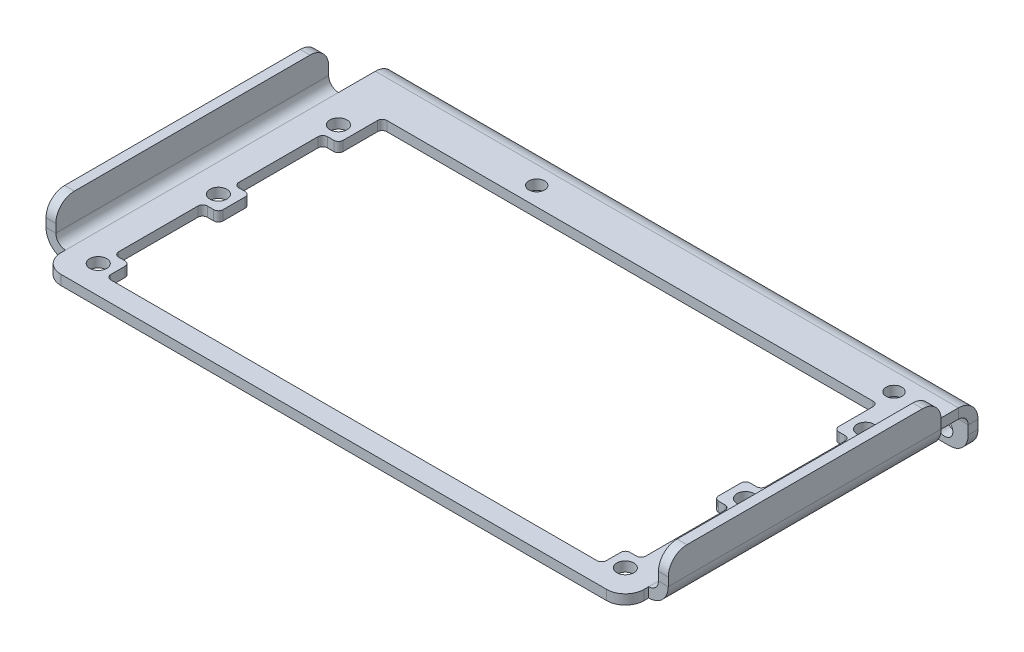
from build123d import *

# Parameters (mm, degrees)
SKETCH1_W                    = 125
SKETCH1_H                    = 73.5
BASE_FLANGE1_DEPTH           = 2.1
EDGE_FLANGE1_STRIP_W         = 12.6
EDGE_FLANGE1_STRIP_H         = 2.1
EDGE_FLANGE1_STRIP_CUT_DEPTH = 125
EDGE_FLANGE1_DEPTH           = 125
CUT_EXTRUDE1_REACH           = 148.302
PSU_MOUNTING_HOLES_D         = 3.6576
FILLET1_R                    = 1
SSD_MOUNTING_HOLES_D         = 3.4
M3_CLEARANCE_HOLE1_D         = 3.4
EDGE_FLANGE2_DEPTH           = 58.5
EDGE_FLANGE2_BEND_DEPTH      = 58.5
FILLET2_R                    = 4


# Sheet-metal steps are written as plain solids
with BuildPart() as part:
    # Sketch1 → Base-Flange1 (new body)
    with BuildSketch(Plane(origin=(0, 0, 0), x_dir=(1, 0, 0), z_dir=(0, 1, 0))):
        with Locations((62.5, 36.75)):
            Rectangle(SKETCH1_W, SKETCH1_H)
    extrude(amount=-BASE_FLANGE1_DEPTH)

    # Edge-Flange1 strip (across the edge) → Edge-Flange1 strip cut (cut)
    with BuildSketch(Plane(origin=(0, -2.1, -73.5), x_dir=(0, 0, 1), z_dir=(1, 0, 0))):
        with Locations((-4.2, -1.05)):
            Rectangle(EDGE_FLANGE1_STRIP_W, EDGE_FLANGE1_STRIP_H)
    extrude(amount=EDGE_FLANGE1_STRIP_CUT_DEPTH, mode=Mode.SUBTRACT)

    # Edge-Flange1 section (across the edge) → Edge-Flange1 (add)
    with BuildSketch(Plane(origin=(0, -2.1, -73.5), x_dir=(0, 0, 1), z_dir=(1, 0, 0))):
        with BuildLine():
            Line((-2.1, 2.1), (-2.1, 8))
            Line((-2.1, 8), (0, 8))
            Line((0, 8), (0, 2.1))
            ThreePointArc((0, 2.1), (0.61507576, 0.61507576), (2.1, 0))
            Line((2.1, 0), (2.1, -2.1))
            ThreePointArc((2.1, -2.1), (-0.869848481, -0.869848481), (-2.1, 2.1))
        make_face()
    extrude(amount=EDGE_FLANGE1_DEPTH)

    # Sketch7 → Cut-Extrude1 (cut, up to next)
    with BuildSketch(Plane(origin=(0, -2.1, 0), x_dir=(-1, 0, 0), z_dir=(0, -1, 0)), mode=Mode.PRIVATE) as cut_extrude1_sk1:
        Polygon((-115.625, 28.375), (-119, 28.375), (-119, 9.375), (-115.625, 9.375), (-115.625, 4.3), (-9.375, 4.3), (-9.375, 9.375), (-6, 9.375), (-6, 28.375), (-9.375, 28.375), (-9.375, 35.125), (-6, 35.125), (-6, 54.125), (-9.375, 54.125), (-9.375, 63.5), (-115.625, 63.5), (-115.625, 54.125), (-119, 54.125), (-119, 35.125), (-115.625, 35.125), align=None)
    cut_extrude1_tool1 = extrude(cut_extrude1_sk1.sketch, amount=-CUT_EXTRUDE1_REACH, mode=Mode.PRIVATE) & part.part
    add(cut_extrude1_tool1.solids().sort_by_distance((62.5, -2.1, -33.81576))[0], mode=Mode.SUBTRACT)

    # psu-mounting-holes (through all)
    with Locations(Plane(origin=(0, 0, 0), x_dir=(1, 0, 0), z_dir=(0, 1, 0))):
        with Locations((119, 6), (119, 57.5), (6, 6), (6, 57.5), (6, 31.75), (119, 31.75)):
            Hole(PSU_MOUNTING_HOLES_D / 2)

    # Fillet1
    fillet1_edges = [part.edges().sort_by_distance(p)[0] for p in [
        (119, -1.05, -28.375),
        (115.625, -1.05, -28.375),
        (115.625, -1.05, -35.125),
        (119, -1.05, -35.125),
        (119, -1.05, -54.125),
        (115.625, -1.05, -54.125),
        (115.625, -1.05, -63.5),
        (9.375, -1.05, -63.5),
        (9.375, -1.05, -54.125),
        (6, -1.05, -54.125),
        (6, -1.05, -35.125),
        (9.375, -1.05, -35.125),
        (9.375, -1.05, -28.375),
        (6, -1.05, -28.375),
        (6, -1.05, -9.375),
        (9.375, -1.05, -9.375),
        (9.375, -1.05, -4.3),
        (115.625, -1.05, -4.3),
        (115.625, -1.05, -9.375),
        (119, -1.05, -9.375),
    ]]
    fillet(fillet1_edges, radius=FILLET1_R)

    # ssd-mounting-holes (through all)
    with Locations(Plane(origin=(0, 0, 0), x_dir=(1, 0, 0), z_dir=(0, 1, 0))):
        with Locations((115.1, 67.5), (38.5, 67.5)):
            Hole(SSD_MOUNTING_HOLES_D / 2)

    # M3 Clearance Hole1 (through all)
    with Locations(Plane.XY.offset(-73.5)):
        with Locations((120, -7.15), (5, -7.15)):
            Hole(M3_CLEARANCE_HOLE1_D / 2)

    # Edge-Flange2 section (across the edge) → Edge-Flange2 (add)
    with BuildSketch(Plane(origin=(127.1, 0, -5), x_dir=(-1, 0, 0), z_dir=(0, 0, -1))):
        with BuildLine():
            Line((-2.1, 2.1), (-2.1, 7.9))
            Line((-2.1, 7.9), (0, 7.9))
            Line((0, 7.9), (0, 2.1))
            ThreePointArc((0, 2.1), (0.61507576, 0.61507576), (2.1, 0))
            Line((2.1, 0), (2.1, -2.1))
            ThreePointArc((2.1, -2.1), (-0.869848481, -0.869848481), (-2.1, 2.1))
        make_face()
    extrude(amount=EDGE_FLANGE2_DEPTH)

    # Edge-Flange2 section 2 (across the edge) → Edge-Flange2 bend (add)
    with BuildSketch(Plane(origin=(-2.1, 0, -63.5), x_dir=(1, 0, 0), z_dir=(0, 0, 1))):
        with BuildLine():
            Line((-2.1, 2.1), (-2.1, 7.9))
            Line((-2.1, 7.9), (0, 7.9))
            Line((0, 7.9), (0, 2.1))
            ThreePointArc((0, 2.1), (0.61507576, 0.61507576), (2.1, 0))
            Line((2.1, 0), (2.1, -2.1))
            ThreePointArc((2.1, -2.1), (-0.869848481, -0.869848481), (-2.1, 2.1))
        make_face()
    extrude(amount=EDGE_FLANGE2_BEND_DEPTH)

    # Fillet2
    fillet2_edges = [part.edges().sort_by_distance(p)[0] for p in [
        (128.15, 7.9, -5),
        (128.15, 7.9, -63.5),
        (0, -10.1, -74.55),
        (-3.15, 7.9, -63.5),
        (-3.15, 7.9, -5),
        (125, -10.1, -74.55),
        (125, -1.05, 0),
        (0, -1.05, 0),
    ]]
    fillet(fillet2_edges, radius=FILLET2_R)


solid = part.part
